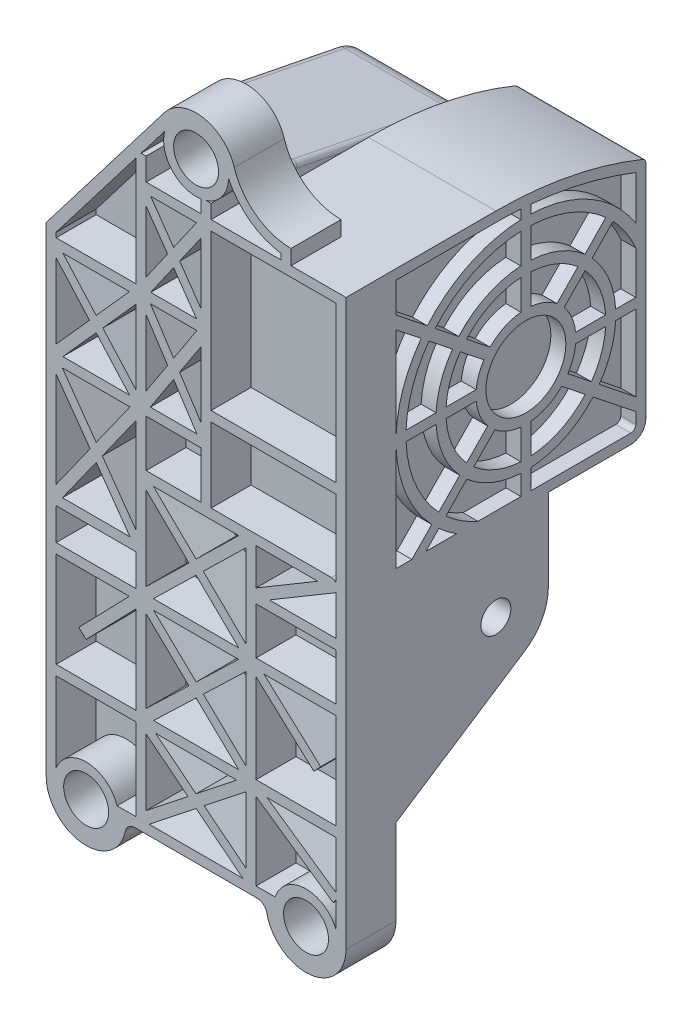
from build123d import *

# Parameters (mm, degrees)
SKETCH1_R                                = 4.5
BOSS_EXTRUDE1_DEPTH                      = 10
SHELL1_START                             = 2
SHELL1_DEPTH                             = 8
FILLET1_R                                = 2
SKETCH2_R                                = 3
BOSS_EXTRUDE2_DEPTH                      = 2
LPATTERN1_COUNT                          = 2
LPATTERN1_PITCH                          = 5.5
BOSS_EXTRUDE3_REACH                      = 103.947
SKETCH3_R                                = 3
MIRROR1_COPY_1_SKETCH_R                  = 3
MIRROR1_COPY_1_DEPTH                     = 2
BOSS_EXTRUDE5_DEPTH                      = 2
BOSS_EXTRUDE6_DEPTH                      = 33
SKETCH5_W                                = 19.5
SKETCH5_H                                = 18
CUT_EXTRUDE1_DEPTH                       = 45
CUT_EXTRUDE2_START                       = -50
SKETCH6_W                                = 7.5
SKETCH6_H                                = 11.607566514
CUT_EXTRUDE2_DEPTH                       = 50
FILLET2_R                                = 3
FILLET3_R                                = 1
CUT_EXTRUDE3_DEPTH                       = 3
SKETCH9_R                                = 18
SKETCH9_R_2                              = 16
SKETCH9_R_3                              = 10
SKETCH9_R_4                              = 8
BOSS_EXTRUDE13_DEPTH                     = 3
BOSS_EXTRUDE16_DEPTH                     = 3
BOSS_EXTRUDE17_DEPTH                     = 3
BOSS_EXTRUDE18_DEPTH                     = 23
FILLET4_R                                = 5
FILLET5_R                                = 15
FILLET6_R                                = 1
FILLET7_R                                = 2
F_4_0MM_CLEARANCE_DOWEL_HOLE1_AT_2_COUNT = 2
F_4_0MM_CLEARANCE_DOWEL_HOLE1_AT_2_PITCH = 40.011481036
EXTRUDE_THIN1_START                      = -8
EXTRUDE_THIN1_OUTLINE_W                  = 11
EXTRUDE_THIN1_OUTLINE_H                  = 9.42643339
EXTRUDE_THIN1_DEPTH                      = 8
EXTRUDE_THIN3_DEPTH                      = 8


# Read off the part's stored shape, not the designer's step: Shell1, Extrude-Thin1
with BuildPart() as part:
    # Sketch1 → Boss-Extrude1 (new body)
    with BuildSketch(Plane.XY):
        with BuildLine():
            Line((21.440191388, 61.09569378), (32.440191388, 61.09569378))
            Line((32.440191388, 61.09569378), (32.440191388, -51.90430622))
            ThreePointArc((32.440191388, -51.90430622), (24.440191388, -59.90430622), (16.440191388, -51.90430622))
            Line((16.440191388, -51.90430622), (-11.559808612, -51.90430622))
            ThreePointArc((-11.559808612, -51.90430622), (-19.559808612, -59.90430622), (-27.559808612, -51.90430622))
            Line((-27.559808612, -51.90430622), (-27.559808612, 44.09569378))
            Line((-27.559808612, 44.09569378), (-3.910039825, 74.961345179))
            ThreePointArc((-3.910039825, 74.961345179), (3.845093075, 77.971368433), (10.08112496, 72.4655322))
            ThreePointArc((10.08112496, 72.4655322), (14.385359971, 66.414136857), (21.440191388, 64.09569378))
            Line((21.440191388, 64.09569378), (21.440191388, 61.09569378))
        make_face()
        with Locations((-19.559808612, -51.90430622)):
            Circle(SKETCH1_R, mode=Mode.SUBTRACT)
        with Locations((24.440191388, -51.90430622)):
            Circle(SKETCH1_R, mode=Mode.SUBTRACT)
        with Locations((2.440191388, 70.09569378)):
            Circle(SKETCH1_R, mode=Mode.SUBTRACT)
    extrude(amount=BOSS_EXTRUDE1_DEPTH)

    # Shell1 outline → Shell1 (cut)
    with BuildSketch(Plane.XY.offset(SHELL1_START)):
        with BuildLine():
            Line((30.440191388, -49.40430622), (30.440191388, 59.09569378))
            Line((30.440191388, 59.09569378), (19.440191388, 59.09569378))
            Line((19.440191388, 59.09569378), (19.440191388, 62.240406336))
            ThreePointArc((19.440191388, 62.240406336), (13.232906652, 64.779092557), (8.938073904, 69.929793789))
            ThreePointArc((8.938073904, 69.929793789), (1.518572745, 63.661362496), (-3.842998085, 71.760485076))
            Line((-3.842998085, 71.760485076), (-25.559808612, 43.417565138))
            Line((-25.559808612, 43.417565138), (-25.559808612, -49.40430622))
            ThreePointArc((-25.559808612, -49.40430622), (-19.293304044, -45.409771955), (-13.375150174, -49.90430622))
            Line((-13.375150174, -49.90430622), (18.255532949, -49.90430622))
            ThreePointArc((18.255532949, -49.90430622), (24.17368682, -45.409771955), (30.440191388, -49.40430622))
        make_face()
    extrude(amount=SHELL1_DEPTH, mode=Mode.SUBTRACT)

    # Fillet1
    fillet1_edges = [part.edges().sort_by_distance(p)[0] for p in [
        (16.440191388, -51.90430622, 5),
        (-11.559808612, -51.90430622, 5),
    ]]
    fillet(fillet1_edges, radius=FILLET1_R)

    # Sketch2 → Boss-Extrude2 (add)
    with BuildSketch(Plane.ZY.offset(27.559808612)):
        with BuildLine():
            Line((-21.453049544, 1.098057112), (0, 4.09569378))
            Line((0, 4.09569378), (0, -34.90430622))
            Line((0, -34.90430622), (-25.741622358, -18.092035219))
            ThreePointArc((-25.741622358, -18.092035219), (-30.247230692, -7.010880633), (-21.453049544, 1.098057112))
        make_face()
        with Locations(Location((-20, -9.300916252, 0), (0, 0, 270))):
            Circle(SKETCH2_R, mode=Mode.SUBTRACT)
    boss_extrude2 = extrude(amount=-BOSS_EXTRUDE2_DEPTH)

    # LPattern1: Boss-Extrude2 ×2
    with Locations(*[(i * LPATTERN1_PITCH, 0, 0) for i in range(1, LPATTERN1_COUNT)]):
        add(boss_extrude2)

    # Sketch3 → Boss-Extrude3 (add, up to next)
    with BuildSketch(Plane(origin=(-25.559808612, 0, 0), x_dir=(0, 0, -1), z_dir=(1, 0, 0)), mode=Mode.PRIVATE) as boss_extrude3_sk1:
        with BuildLine():
            Line((20.76112119, -3.853834966), (5, -1.651531992))
            Line((5, -1.651531992), (5, -25.666789119))
            Line((5, -25.666789119), (23.007516473, -13.905788092))
            ThreePointArc((23.007516473, -13.905788092), (25.367597029, -8.101373785), (20.76112119, -3.853834966))
        make_face()
        with Locations(Location((20, -9.300916252, 0), (0, 0, 270))):
            Circle(SKETCH3_R, mode=Mode.SUBTRACT)
    boss_extrude3_tool1 = extrude(boss_extrude3_sk1.sketch, amount=BOSS_EXTRUDE3_REACH, mode=Mode.PRIVATE) - part.part
    boss_extrude3 = boss_extrude3_tool1.solids().sort_by_distance((-25.559809, -11.782136, -12.643041))[0]
    add(boss_extrude3)

    # Mirror1: Boss-Extrude2, Boss-Extrude3 across plane
    add(boss_extrude2.mirror(Plane.ZY.offset(-2.440191388)))
    add(boss_extrude3.mirror(Plane.ZY.offset(-2.440191388)))

    # Mirror1 copy 1 sketch → Mirror1 copy 1 (add)
    with BuildSketch(Plane(origin=(26.940191388, 0, 0), x_dir=(0, 0, 1), z_dir=(1, 0, 0))):
        with BuildLine():
            Line((-21.453049544, -1.098057112), (0, -4.09569378))
            Line((0, -4.09569378), (0, 34.90430622))
            Line((0, 34.90430622), (-25.741622358, 18.092035219))
            ThreePointArc((-25.741622358, 18.092035219), (-30.247230692, 7.010880633), (-21.453049544, -1.098057112))
        make_face()
        with Locations((-20, 9.300916252)):
            Circle(MIRROR1_COPY_1_SKETCH_R, mode=Mode.SUBTRACT)
    extrude(amount=-MIRROR1_COPY_1_DEPTH)

    # Sketch4 → Boss-Extrude5 (add)
    with BuildSketch(Plane(origin=(32.440191388, 0, 0), x_dir=(0, 0, -1), z_dir=(1, 0, 0))):
        with BuildLine():
            Line((30.5, -9.300916252), (30.5, 7.09569378))
            Line((30.5, 7.09569378), (0, 7.09569378))
            Line((0, 7.09569378), (0, 4.09569378))
            Line((0, 4.09569378), (21.453049544, 1.098057112))
            ThreePointArc((21.453049544, 1.098057112), (27.921711312, -2.409146531), (30.5, -9.300916252))
        make_face()
    extrude(amount=-BOSS_EXTRUDE5_DEPTH)

    # Sketch4<3> → Boss-Extrude6 (add)
    with BuildSketch(Plane(origin=(32.440191388, 0, 0), x_dir=(0, 0, -1), z_dir=(1, 0, 0))):
        with BuildLine():
            Line((50, 7.09569378), (50, 55.09569378))
            ThreePointArc((50, 55.09569378), (35.297058541, 59.580986484), (20, 61.09569378))
            Line((20, 61.09569378), (0, 61.09569378))
            Line((0, 61.09569378), (0, 7.09569378))
            Line((0, 7.09569378), (30.5, 7.09569378))
            Line((30.5, 7.09569378), (50, 7.09569378))
        make_face()
    extrude(amount=-BOSS_EXTRUDE6_DEPTH)

    # Sketch5 → Cut-Extrude1 (cut)
    with BuildSketch(Plane(origin=(0, 0, -50), x_dir=(-1, 0, 0), z_dir=(0, 0, -1))):
        with Locations((-17.690191388, 16.09569378)):
            Rectangle(SKETCH5_W, SKETCH5_H)
    extrude(amount=-CUT_EXTRUDE1_DEPTH, mode=Mode.SUBTRACT)

    # Sketch6 → Cut-Extrude2 (cut)
    with BuildSketch(Plane(origin=(0, 0, -50), x_dir=(-1, 0, 0), z_dir=(0, 0, -1)).offset(CUT_EXTRUDE2_START)):
        with Locations((-3.190191388, 55.899477037)):
            Rectangle(SKETCH6_W, SKETCH6_H)
    extrude(amount=CUT_EXTRUDE2_DEPTH, mode=Mode.SUBTRACT)

    # Fillet2
    fillet2_edges = [part.edges().sort_by_distance(p)[0] for p in [
        (3.690191388, 7.09569378, -50),
        (29.940191388, 7.09569378, -50),
    ]]
    fillet(fillet2_edges, radius=FILLET2_R)

    # Fillet3
    fillet3_edges = [part.edges().sort_by_distance(p)[0] for p in [
        (19.690191388, 55.09569378, -50),
    ]]
    fillet(fillet3_edges, radius=FILLET3_R)

    # Sketch8 → Cut-Extrude3 (cut)
    with BuildSketch(Plane(origin=(32.440191388, 0, 0), x_dir=(0, 0, -1), z_dir=(1, 0, 0))):
        with BuildLine():
            Line((0, 59.09569378), (0, 9.09569378))
            Line((0, 9.09569378), (30.5, 9.09569378))
            Line((30.5, 9.09569378), (47, 9.09569378))
            ThreePointArc((47, 9.09569378), (47.707106781, 9.388586999), (48, 10.09569378))
            Line((48, 10.09569378), (48, 53.749780711))
            ThreePointArc((48, 53.749780711), (34.252883801, 57.747253063), (20, 59.09569378))
            Line((20, 59.09569378), (0, 59.09569378))
        make_face()
    extrude(amount=-CUT_EXTRUDE3_DEPTH, mode=Mode.SUBTRACT)

    # Sketch9 → Boss-Extrude13 (add)
    # profile 1 of 2: a face of its own
    with BuildSketch(Plane(origin=(29.440191388, 0, 0), x_dir=(0, 0, -1), z_dir=(1, 0, 0))):
        with Locations(Location((26, 31.09569378, 0), (0, 0, 90))):
            Circle(SKETCH9_R)
        with Locations(Location((26, 31.09569378, 0), (0, 0, 90))):
            Circle(SKETCH9_R_2, mode=Mode.SUBTRACT)
    # profile 2 of 2: a face of its own
    with BuildSketch(Plane(origin=(29.440191388, 0, 0), x_dir=(0, 0, -1), z_dir=(1, 0, 0))):
        with Locations(Location((26, 31.09569378, 0), (0, 0, 90))):
            Circle(SKETCH9_R_3)
        with Locations(Location((26, 31.09569378, 0), (0, 0, 90))):
            Circle(SKETCH9_R_4, mode=Mode.SUBTRACT)
    extrude(amount=BOSS_EXTRUDE13_DEPTH)



with BuildPart() as body_2:
    # Sketch9<5> → Boss-Extrude16 (new body)
    with BuildSketch(Plane(origin=(29.440191388, 0, 0), x_dir=(0, 0, -1), z_dir=(1, 0, 0))):
        with BuildLine():
            Line((12.143593539, 9.09569378), (16.408336953, 9.09569378))
            ThreePointArc((16.408336953, 9.09569378), (9.029437252, 48.066256528), (48, 40.687356827))
            Line((48, 40.687356827), (48, 44.95210024))
            ThreePointArc((48, 44.95210024), (7.615223689, 49.480470091), (12.143593539, 9.09569378))
        make_face()
    extrude(amount=BOSS_EXTRUDE16_DEPTH)


with BuildPart() as part_1:
    add(part.part)

    add(body_2.part)  # Boss-Extrude17 merges body 2
    # Sketch11 → Boss-Extrude17 (add)
    with BuildSketch(Plane(origin=(29.440191388, 0, 0), x_dir=(0, 0, -1), z_dir=(1, 0, 0))):
        with BuildLine():
            Line((25, 13.123493024), (25, 9.09569378))
            Line((25, 9.09569378), (27, 9.09569378))
            Line((27, 9.09569378), (27, 13.123493024))
            ThreePointArc((27, 13.123493024), (26, 13.09569378), (25, 13.123493024))
        make_face()
        with BuildLine():
            Line((25, 21.145819409), (25, 15.126974357))
            ThreePointArc((25, 15.126974357), (26, 15.09569378), (27, 15.126974357))
            Line((27, 15.126974357), (27, 21.145819409))
            ThreePointArc((27, 21.145819409), (26, 21.09569378), (25, 21.145819409))
        make_face()
        with BuildLine():
            Line((9.99073826, 13.21543823), (14.180683133, 17.519842101))
            ThreePointArc((14.180683133, 17.519842101), (13.444722933, 18.197437395), (12.747543535, 18.914872886))
            Line((12.747543535, 18.914872886), (8.557598662, 14.610469015))
            ThreePointArc((8.557598662, 14.610469015), (9.259630578, 13.8980186), (9.99073826, 13.21543823))
        make_face()
        with BuildLine():
            ThreePointArc((40.68901049, 20.692186159), (40.088352101, 19.892197224), (39.44417754, 19.126813704))
            Line((39.44417754, 19.126813704), (48, 12.3229571))
            Line((48, 12.3229571), (48, 14.878259505))
            Line((48, 14.878259505), (40.68901049, 20.692186159))
        make_face()
        with BuildLine():
            ThreePointArc((14.145002604, 20.350507103), (14.839753719, 19.630576993), (15.578142202, 18.955476317))
            Line((15.578142202, 18.955476317), (19.776379271, 23.268398907))
            ThreePointArc((19.776379271, 23.268398907), (19.024846074, 23.929995788), (18.343239673, 24.663429693))
            Line((18.343239673, 24.663429693), (14.145002604, 20.350507103))
        make_face()
        with BuildLine():
            Line((3.189467578, 9.09569378), (5.980542505, 9.09569378))
            Line((5.980542505, 9.09569378), (8.594588314, 11.781148897))
            ThreePointArc((8.594588314, 11.781148897), (7.864599793, 12.464879001), (7.161448715, 13.176179682))
            Line((7.161448715, 13.176179682), (3.189467578, 9.09569378))
        make_face()
        with BuildLine():
            Line((33.165213163, 24.120041816), (37.876080293, 20.373813493))
            ThreePointArc((37.876080293, 20.373813493), (38.522979645, 21.137030174), (39.120913243, 21.939185949))
            Line((39.120913243, 21.939185949), (34.410046114, 25.685414272))
            ThreePointArc((34.410046114, 25.685414272), (33.826862278, 24.871529026), (33.165213163, 24.120041816))
        make_face()
        with BuildLine():
            Line((2.020842383, 30.09569378), (8.027799244, 30.09569378))
            ThreePointArc((8.027799244, 30.09569378), (8, 31.09569378), (8.027799244, 32.09569378))
            Line((8.027799244, 32.09569378), (2.020842383, 32.09569378))
            ThreePointArc((2.020842383, 32.09569378), (2, 31.09569378), (2.020842383, 30.09569378))
        make_face()
        with BuildLine():
            ThreePointArc((43.972200756, 32.09569378), (44, 31.09569378), (43.972200756, 30.09569378))
            Line((43.972200756, 30.09569378), (48, 30.09569378))
            Line((48, 30.09569378), (48, 32.09569378))
            Line((48, 32.09569378), (43.972200756, 32.09569378))
        make_face()
        with BuildLine():
            ThreePointArc((10.031280577, 32.09569378), (10, 31.09569378), (10.031280577, 30.09569378))
            Line((10.031280577, 30.09569378), (16.050125629, 30.09569378))
            ThreePointArc((16.050125629, 30.09569378), (16, 31.09569378), (16.050125629, 32.09569378))
            Line((16.050125629, 32.09569378), (10.031280577, 32.09569378))
        make_face()
        with BuildLine():
            Line((0, 30.09569378), (0.019237886, 30.09569378))
            ThreePointArc((0.019237886, 30.09569378), (0.004809917, 30.595601247), (0, 31.095693745))
            Line((0, 31.095693745), (0, 30.09569378))
        make_face()
        with BuildLine():
            Line((35.949874371, 30.09569378), (41.968719423, 30.09569378))
            ThreePointArc((41.968719423, 30.09569378), (42, 31.09569378), (41.968719423, 32.09569378))
            Line((41.968719423, 32.09569378), (35.949874371, 32.09569378))
            ThreePointArc((35.949874371, 32.09569378), (36, 31.09569378), (35.949874371, 30.09569378))
        make_face()
        with BuildLine():
            Line((6.609427103, 45.238030317), (11.31098951, 41.499201401))
            ThreePointArc((11.31098951, 41.499201401), (11.911647899, 42.299190336), (12.55582246, 43.064573856))
            Line((12.55582246, 43.064573856), (7.854260054, 46.803402773))
            ThreePointArc((7.854260054, 46.803402773), (7.215530532, 46.033689188), (6.609427103, 45.238030317))
        make_face()
        with BuildLine():
            Line((0, 32.09569378), (0, 31.095693745))
            ThreePointArc((0, 31.095693745), (0.004809916, 31.595786278), (0.019237886, 32.09569378))
            Line((0.019237886, 32.09569378), (0, 32.09569378))
        make_face()
        with BuildLine():
            ThreePointArc((14.123919707, 41.817574067), (13.477020355, 41.054357385), (12.879086757, 40.252201611))
            Line((12.879086757, 40.252201611), (17.589953886, 36.505973288))
            ThreePointArc((17.589953886, 36.505973288), (18.173137722, 37.319858533), (18.834786837, 38.071345744))
            Line((18.834786837, 38.071345744), (14.123919707, 41.817574067))
        make_face()
        with BuildLine():
            Line((0, 50.494052687), (5.04279883, 46.483861933))
            ThreePointArc((5.04279883, 46.483861933), (5.650158077, 47.278522139), (6.287631781, 48.049234389))
            Line((6.287631781, 48.049234389), (0, 53.049355092))
            Line((0, 53.049355092), (0, 50.494052687))
        make_face()
        with BuildLine():
            ThreePointArc((37.819316867, 44.671545459), (38.555277067, 43.993950165), (39.252456465, 43.276514674))
            Line((39.252456465, 43.276514674), (43.442401338, 47.580918545))
            ThreePointArc((43.442401338, 47.580918545), (42.740369422, 48.29336896), (42.00926174, 48.97594933))
            Line((42.00926174, 48.97594933), (37.819316867, 44.671545459))
        make_face()
        with BuildLine():
            Line((25, 55.074851396), (25, 49.067894536))
            ThreePointArc((25, 49.067894536), (26, 49.09569378), (27, 49.067894536))
            Line((27, 49.067894536), (27, 55.074851396))
            ThreePointArc((27, 55.074851396), (26, 55.09569378), (25, 55.074851396))
        make_face()
        with BuildLine():
            Line((33.656760327, 37.527957867), (37.854997396, 41.840880457))
            ThreePointArc((37.854997396, 41.840880457), (37.160246281, 42.560810567), (36.421857798, 43.235911242))
            Line((36.421857798, 43.235911242), (32.223620729, 38.922988652))
            ThreePointArc((32.223620729, 38.922988652), (32.975153926, 38.261391772), (33.656760327, 37.527957867))
        make_face()
        with BuildLine():
            ThreePointArc((27, 47.064413203), (26, 47.09569378), (25, 47.064413203))
            Line((25, 47.064413203), (25, 41.045568151))
            ThreePointArc((25, 41.045568151), (26, 41.09569378), (27, 41.045568151))
            Line((27, 41.045568151), (27, 47.064413203))
        make_face()
        with BuildLine():
            Line((25, 58.931041738), (25, 57.076455893))
            ThreePointArc((25, 57.076455893), (26, 57.09569378), (27, 57.076455893))
            Line((27, 57.076455893), (27, 58.77263875))
            ThreePointArc((27, 58.77263875), (26.000522717, 58.858440081), (25, 58.931041738))
        make_face()
    extrude(amount=BOSS_EXTRUDE17_DEPTH)

    # Extrude-Thin1 outline → Extrude-Thin1 (add)
    # profile 1 of 3: a face of its own
    with BuildSketch(Plane.XY.offset(10).offset(EXTRUDE_THIN1_START)):
        with BuildLine():
            Line((19.440191388, 61.09569378), (5.440191388, 61.09569378))
            Line((5.440191388, 61.09569378), (5.440191388, 63.911035341))
            Line((5.440191388, 63.911035341), (4.440191388, 63.911035342))
            ThreePointArc((4.440191388, 63.911035342), (3.944902651, 63.772257688), (3.440191388, 63.673077491))
            Line((3.440191388, 63.673077491), (3.440191388, 61.09569378))
            Line((3.440191388, 61.09569378), (-7.559808612, 61.09569378))
            Line((-7.559808612, 61.09569378), (-7.559808612, 65.604508212))
            Line((-7.559808612, 65.604508212), (-8.559808612, 65.604508212))
            Line((-8.559808612, 65.604508212), (-9.559808612, 64.299393914))
            Line((-9.559808612, 64.299393914), (-9.559808612, 42.444847687))
            Line((-9.559808612, 42.444847687), (-25.559808612, 42.444847687))
            Line((-25.559808612, 42.444847687), (-25.559808612, 40.444847687))
            Line((-25.559808612, 40.444847687), (-9.559808612, 40.444847687))
            Line((-9.559808612, 40.444847687), (-9.559808612, 22.52212717))
            Line((-9.559808612, 22.52212717), (-25.559808612, 22.52212717))
            Line((-25.559808612, 22.52212717), (-25.559808612, 20.52212717))
            Line((-25.559808612, 20.52212717), (-9.559808612, 20.52212717))
            Line((-9.559808612, 20.52212717), (-9.559808612, -1.993370541))
            Line((-9.559808612, -1.993370541), (-25.559808612, -1.993370541))
            Line((-25.559808612, -1.993370541), (-25.559808612, -3.993370541))
            Line((-25.559808612, -3.993370541), (-9.559808612, -3.993370541))
            Line((-9.559808612, -3.993370541), (-9.559808612, -10.376916044))
            Line((-9.559808612, -10.376916044), (-25.559808612, -10.376916044))
            Line((-25.559808612, -10.376916044), (-25.559808612, -12.376916044))
            Line((-25.559808612, -12.376916044), (-10.921417067, -12.376916044))
            Line((-10.921417067, -12.376916044), (-21.030908054, -22.808921685))
            Line((-21.030908054, -22.808921685), (-19.594667446, -24.200759648))
            Line((-19.594667446, -24.200759648), (-9.559808612, -13.845767088))
            Line((-9.559808612, -13.845767088), (-9.559808612, -31.483591886))
            Line((-9.559808612, -31.483591886), (-25.559808612, -31.483591886))
            Line((-25.559808612, -31.483591886), (-25.559808612, -33.483591886))
            Line((-25.559808612, -33.483591886), (-9.559808612, -33.483591886))
            Line((-9.559808612, -33.483591886), (-9.559808612, -49.90430622))
            Line((-9.559808612, -49.90430622), (-6.948962096, -49.90430622))
            Line((-6.948962096, -49.90430622), (2.440191388, -42.469498917))
            Line((2.440191388, -42.469498917), (11.829344871, -49.90430622))
            Line((11.829344871, -49.90430622), (14.440191388, -49.90430622))
            Line((14.440191388, -49.90430622), (14.440191388, -34.392742899))
            Line((14.440191388, -34.392742899), (29.870775095, -45.081184036))
            Line((29.870775095, -45.081184036), (30.440191388, -44.259134716))
            Line((30.440191388, -44.259134716), (30.440191388, -43.042662692))
            Line((30.440191388, -43.042662692), (16.640045945, -33.483591886))
            Line((16.640045945, -33.483591886), (30.440191388, -33.483591886))
            Line((30.440191388, -33.483591886), (30.440191388, -31.483591886))
            Line((30.440191388, -31.483591886), (14.440191388, -31.483591886))
            Line((14.440191388, -31.483591886), (14.440191388, -13.648262835))
            Line((14.440191388, -13.648262835), (26.011667827, -24.242408713))
            Line((26.011667827, -24.242408713), (27.362213459, -22.767272619))
            Line((27.362213459, -22.767272619), (16.013326282, -12.376916044))
            Line((16.013326282, -12.376916044), (30.440191388, -12.376916044))
            Line((30.440191388, -12.376916044), (30.440191388, -10.376916044))
            Line((30.440191388, -10.376916044), (14.440191388, -10.376916044))
            Line((14.440191388, -10.376916044), (14.440191388, -1))
            Line((14.440191388, -1), (30.440191388, -1))
            Line((30.440191388, -1), (30.440191388, 1))
            Line((30.440191388, 1), (17.08251399, 1))
            Line((17.08251399, 1), (30.167875035, 8.770929301))
            ThreePointArc((30.167875035, 8.770929301), (30.311695073, 8.870581432), (30.440191388, 8.989339368))
            Line((30.440191388, 8.989339368), (30.440191388, 10.702048192))
            ThreePointArc((30.440191388, 10.702048192), (30.02562333, 10.993069702), (29.529610737, 11.09569378))
            Line((29.529610737, 11.09569378), (5.440191388, 11.09569378))
            Line((5.440191388, 11.09569378), (5.440191388, 26.009512905))
            Line((5.440191388, 26.009512905), (30.440191388, 26.009512905))
            Line((30.440191388, 26.009512905), (30.440191388, 28.009512905))
            Line((30.440191388, 28.009512905), (5.440191388, 28.009512905))
            Line((5.440191388, 28.009512905), (5.440191388, 59.09569378))
            Line((5.440191388, 59.09569378), (19.440191388, 59.09569378))
            Line((19.440191388, 59.09569378), (19.440191388, 61.09569378))
        make_face()
        Polygon((-7.559808612, -47.836905705), (-7.559808612, -34.550992401), (0.829344871, -41.193949053), align=None, mode=Mode.SUBTRACT)
        Polygon((2.440191388, -39.918399189), (-5.686097694, -33.483591886), (10.566480469, -33.483591886), align=None, mode=Mode.SUBTRACT)
        Polygon((0.995739992, -21.930253965), (-7.559808612, -30.138399012), (-7.559808612, -13.722108918), align=None, mode=Mode.SUBTRACT)
        Polygon((10.953415745, -31.483591886), (-6.07303297, -31.483591886), (2.440191388, -23.316052482), align=None, mode=Mode.SUBTRACT)
        Polygon((-6.07303297, -12.376916044), (10.953415745, -12.376916044), (2.440191388, -20.544455447), align=None, mode=Mode.SUBTRACT)
        Polygon((2.440191388, -2.037976549), (10.983944121, -10.376916044), (-6.103561346, -10.376916044), align=None, mode=Mode.SUBTRACT)
        Polygon((1.008505187, -0.640611132), (-7.559808612, -9.003522907), (-7.559808612, 7.722300644), align=None, mode=Mode.SUBTRACT)
        Polygon((-6.103561346, 9.09569378), (10.983944121, 9.09569378), (2.440191388, 0.756754285), align=None, mode=Mode.SUBTRACT)
        Polygon((4.051037904, -41.193949053), (12.440191388, -34.550992401), (12.440191388, -47.836905705), align=None, mode=Mode.SUBTRACT)
        Polygon((12.440191388, -13.722108918), (12.440191388, -30.138399012), (3.884642784, -21.930253965), align=None, mode=Mode.SUBTRACT)
        Polygon((12.440191388, -9.003522907), (3.871877588, -0.640611132), (12.440191388, 7.722300644), align=None, mode=Mode.SUBTRACT)
        Polygon((26.797868785, 9.09569378), (14.440191388, 1.756909848), (14.440191388, 9.09569378), align=None, mode=Mode.SUBTRACT)
        with Locations((-2.059808612, 15.808910475)):
            Rectangle(EXTRUDE_THIN1_OUTLINE_W, EXTRUDE_THIN1_OUTLINE_H, mode=Mode.SUBTRACT)
        Polygon((-3.253870621, 31.483487429), (-7.559808612, 24.884564416), (-7.559808612, 38.082410442), align=None, mode=Mode.SUBTRACT)
        Polygon((2.593608053, 22.52212717), (-6.713225278, 22.52212717), (-2.059808612, 29.653567146), align=None, mode=Mode.SUBTRACT)
        Polygon((3.440191388, 38.082410442), (3.440191388, 24.884564416), (-0.865746604, 31.483487429), align=None, mode=Mode.SUBTRACT)
        Polygon((-2.059808612, 33.313407711), (-6.713225278, 40.444847687), (2.593608053, 40.444847687), align=None, mode=Mode.SUBTRACT)
        Polygon((-3.27875731, 50.770270734), (-7.559808612, 44.628330045), (-7.559808612, 56.912211422), align=None, mode=Mode.SUBTRACT)
        Polygon((2.524223373, 42.444847687), (-6.643840598, 42.444847687), (-2.059808612, 49.021468845), align=None, mode=Mode.SUBTRACT)
        Polygon((-2.059808612, 52.519072623), (-6.643840598, 59.09569378), (2.524223373, 59.09569378), align=None, mode=Mode.SUBTRACT)
        Polygon((3.440191388, 56.912211422), (3.440191388, 44.628330045), (-0.840859915, 50.770270734), align=None, mode=Mode.SUBTRACT)
    # profile 2 of 3: a face of its own
    with BuildSketch(Plane.XY.offset(10).offset(EXTRUDE_THIN1_START)):
        Polygon((14.440191388, -51.90430622), (14.355073676, -51.90430622), (14.440191388, -51.971706735), align=None)
    # profile 3 of 3: a face of its own
    with BuildSketch(Plane.XY.offset(10).offset(EXTRUDE_THIN1_START)):
        Polygon((-9.559808612, -51.971706735), (-9.474690901, -51.90430622), (-9.559808612, -51.90430622), align=None)
    extrude(amount=EXTRUDE_THIN1_DEPTH)

    # Sketch17 → Extrude-Thin3 (add)
    with BuildSketch(Plane.XY.offset(10)):
        Polygon((-26.3057965, 39.778888176), (-10.3057965, 21.856167658), (-8.813820725, 23.188086682), (-24.813820725, 41.110807199), align=None)
        Polygon((-10.3057965, 41.110807199), (-26.3057965, 23.188086682), (-24.813820725, 21.856167658), (-8.813820725, 39.778888176), align=None)
        Polygon((-26.374952329, 19.942868402), (-10.374952329, -2.572629309), (-8.744664895, -1.414111773), (-24.744664895, 21.101385938), align=None)
        Polygon((-10.37533146, 21.100852048), (-26.35332503, -1.414887834), (-24.722279334, -2.57233759), (-8.744285765, 19.943402292), align=None)
    extrude(amount=-EXTRUDE_THIN3_DEPTH)


with BuildPart() as body_2_2:
    # Sketch12 → Boss-Extrude18 (new body)
    with BuildSketch(Plane.ZY.offset(1.559808612)):
        Polygon((-48.812755248, 48.588011328), (-48.812755248, 13.588011328), (-6.679798463, 9.551708542), (-8.593611464, 56.551708542), align=None)
    extrude(amount=BOSS_EXTRUDE18_DEPTH)

    # Fillet4
    fillet4_edges = [body_2_2.edges().sort_by_distance(p)[0] for p in [
        (-13.059808612, 56.551708542, -8.593611464),
        (-13.059808612, 9.551708542, -6.679798463),
        (-13.059808612, 48.588011328, -48.812755248),
    ]]
    fillet(fillet4_edges, radius=FILLET4_R)

    # Fillet5
    fillet5_edges = [body_2_2.edges().sort_by_distance(p)[0] for p in [
        (-13.059808612, 13.588011328, -48.812755248),
    ]]
    fillet(fillet5_edges, radius=FILLET5_R)

    # Fillet6
    fillet6_edges = [body_2_2.edges().sort_by_distance(p)[0] for p in [
        (-1.559808612, 32.997432675, -7.634494881),
        (-1.559808612, 52.401494622, -29.553480465),
        (-1.559808612, 35.850335896, -48.812755248),
        (-1.559808612, 47.65462257, -47.676426619),
        (-1.559808612, 54.439913647, -10.257463608),
        (-1.559808612, 11.444453695, -8.471543445),
        (-1.559808612, 11.193192998, -23.814438089),
        (-1.559808612, 17.131501004, -44.913579137),
    ]]
    fillet(fillet6_edges, radius=FILLET6_R)

    # Fillet7
    fillet7_edges = [body_2_2.edges().sort_by_distance(p)[0] for p in [
        (-24.559808612, 32.997432675, -7.634494881),
        (-24.559808612, 52.401494622, -29.553480465),
        (-24.559808612, 35.850335896, -48.812755248),
        (-24.559808612, 47.65462257, -47.676426619),
        (-24.559808612, 54.439913647, -10.257463608),
        (-24.559808612, 11.444453695, -8.471543445),
        (-24.559808612, 11.193192998, -23.814438089),
        (-24.559808612, 17.131501004, -44.913579137),
    ]]
    fillet(fillet7_edges, radius=FILLET7_R)

    # Sketch15 → Ø4.0mm Clearance Dowel Hole1 (revolve, cut)
    with BuildSketch(Plane(origin=(-24.559808612, 43.281339689, -42.782963741), x_dir=(0, 0, 1), z_dir=(0, 1, 0))):
        Polygon((0, 0), (0, 6.201721238), (2, 5), (2, 0), align=None)
    f_4_0mm_clearance_dowel_hole1 = revolve(axis=Axis((-30.909808612, 43.281339689, -42.782963741), (1, 0, 0)), mode=Mode.SUBTRACT)

    # Ø4.0mm Clearance Dowel Hole1 at 2: Ø4.0mm Clearance Dowel Hole1 ×2
    with Locations(*[Vector(0, -0.6776111554240188, 0.7354203709749453) * (i * F_4_0MM_CLEARANCE_DOWEL_HOLE1_AT_2_PITCH) for i in range(1, F_4_0MM_CLEARANCE_DOWEL_HOLE1_AT_2_COUNT)]):
        add(f_4_0mm_clearance_dowel_hole1, mode=Mode.SUBTRACT)


solid = Compound([part_1.part, body_2_2.part])
